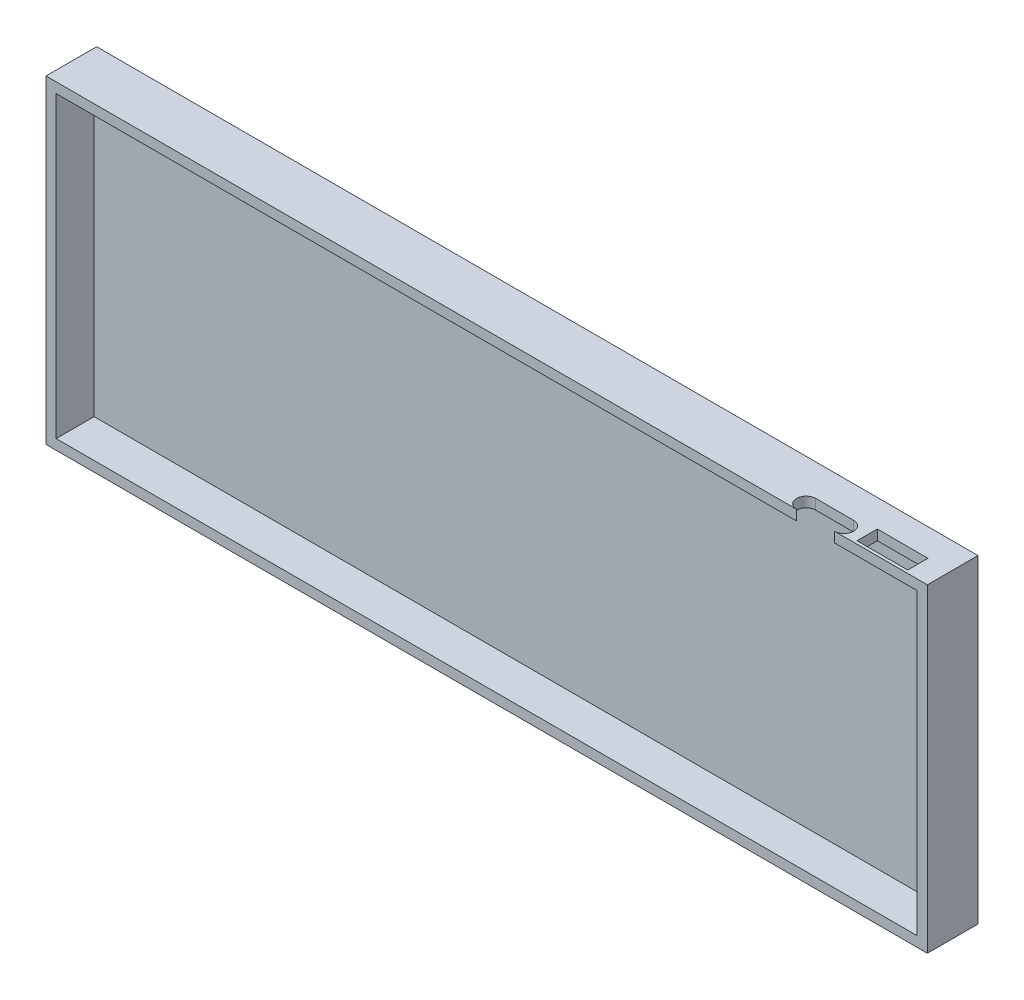
from build123d import *

# Parameters (mm, degrees)
SKETCH1_W           = 348
SKETCH1_H           = 126
BOSS_EXTRUDE1_DEPTH = 20
SKETCH2_W           = 340
SKETCH2_H           = 118
CUT_EXTRUDE1_DEPTH  = 15
CUT_EXTRUDE2_REACH  = 217.759
CUT_EXTRUDE3_REACH  = 217.759
SKETCH5_W           = 20
SKETCH5_H           = 8


with BuildPart() as part:
    # Sketch1 → Boss-Extrude1 (new body)
    with BuildSketch(Plane.XY):
        Rectangle(SKETCH1_W, SKETCH1_H)
    extrude(amount=BOSS_EXTRUDE1_DEPTH)

    # Sketch2 → Cut-Extrude1 (cut)
    with BuildSketch(Plane.XY.offset(20)):
        Rectangle(SKETCH2_W, SKETCH2_H)
    extrude(amount=-CUT_EXTRUDE1_DEPTH, mode=Mode.SUBTRACT)

    # Sketch4 → Cut-Extrude2 (cut, up to next)
    with BuildSketch(Plane(origin=(0, 63, 0), x_dir=(1, 0, 0), z_dir=(0, 1, 0)), mode=Mode.PRIVATE) as cut_extrude2_sk1:
        with BuildLine():
            Line((122.39, -12.5), (137.39, -12.5))
            ThreePointArc((137.39, -12.5), (141.14, -16.25), (137.39, -20))
            Line((137.39, -20), (122.39, -20))
            ThreePointArc((122.39, -20), (118.64, -16.25), (122.39, -12.5))
        make_face()
    cut_extrude2_tool1 = extrude(cut_extrude2_sk1.sketch, amount=-CUT_EXTRUDE2_REACH, mode=Mode.PRIVATE) & part.part
    add(cut_extrude2_tool1.solids().sort_by_distance((129.89, 63, 16.25))[0], mode=Mode.SUBTRACT)

    # Sketch5 → Cut-Extrude3 (cut, up to next)
    with BuildSketch(Plane(origin=(0, 63, 0), x_dir=(1, 0, 0), z_dir=(0, 1, 0)), mode=Mode.PRIVATE) as cut_extrude3_sk1:
        with Locations((155.05, -14.81)):
            Rectangle(SKETCH5_W, SKETCH5_H)
    cut_extrude3_tool1 = extrude(cut_extrude3_sk1.sketch, amount=-CUT_EXTRUDE3_REACH, mode=Mode.PRIVATE) & part.part
    add(cut_extrude3_tool1.solids().sort_by_distance((155.05, 63, 14.81))[0], mode=Mode.SUBTRACT)


solid = part.part
